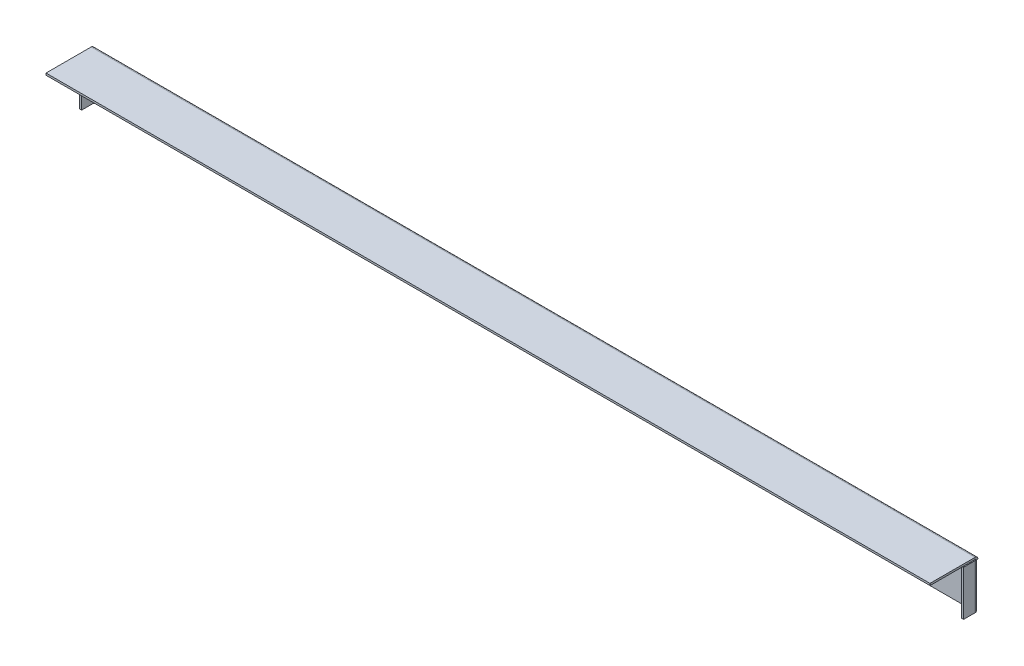
from build123d import *

# Parameters (mm, degrees)
BASEFLANGE_W                   = 920
BASEFLANGE_H                   = 50
BASE_FLANGE1_DEPTH             = 2
EDGE_FLANGE1_STRIP_W           = 10
EDGE_FLANGE1_STRIP_H           = 2
EDGE_FLANGE1_STRIP_CUT_DEPTH   = 920
EDGE_FLANGE1_DEPTH             = 920
EDGE_FLANGE2_STRIP_W           = 10
EDGE_FLANGE2_STRIP_H           = 2
EDGE_FLANGE2_STRIP_CUT_DEPTH   = 47
EDGE_FLANGE2_STRIP_2_W         = 10
EDGE_FLANGE2_STRIP_2_H         = 2
EDGE_FLANGE2_STRIP_CUT_2_DEPTH = 47
EDGE_FLANGE2_DEPTH             = 47
EDGE_FLANGE2_BEND_DEPTH        = 47


# Sheet-metal steps are written as plain solids
with BuildPart() as part:
    # BaseFlange → Base-Flange1 (new body)
    with BuildSketch(Plane.XY):
        with Locations((0, -25)):
            Rectangle(BASEFLANGE_W, BASEFLANGE_H)
    extrude(amount=BASE_FLANGE1_DEPTH)

    # Edge-Flange1 strip (across the edge) → Edge-Flange1 strip cut (cut)
    with BuildSketch(Plane(origin=(460, 0, 2), x_dir=(0, -1, 0), z_dir=(-1, 0, 0))):
        with Locations((-2, -1)):
            Rectangle(EDGE_FLANGE1_STRIP_W, EDGE_FLANGE1_STRIP_H)
    extrude(amount=EDGE_FLANGE1_STRIP_CUT_DEPTH, mode=Mode.SUBTRACT)

    # Edge-Flange1 section (across the edge) → Edge-Flange1 (add)
    with BuildSketch(Plane(origin=(460, 0, 2), x_dir=(0, -1, 0), z_dir=(-1, 0, 0))):
        with BuildLine():
            Line((0, 1), (0, 48))
            Line((0, 48), (2, 48))
            Line((2, 48), (2, 1))
            ThreePointArc((2, 1), (2.292893219, 0.292893219), (3, 0))
            Line((3, 0), (3, -2))
            ThreePointArc((3, -2), (0.878679656, -1.121320344), (0, 1))
        make_face()
    extrude(amount=EDGE_FLANGE1_DEPTH)

    # Edge-Flange2 strip (across the edge) → Edge-Flange2 strip cut (cut)
    with BuildSketch(Plane(origin=(460, -50, 2), x_dir=(-1, 0, 0), z_dir=(0, 1, 0))):
        with Locations((-2, -1)):
            Rectangle(EDGE_FLANGE2_STRIP_W, EDGE_FLANGE2_STRIP_H)
    extrude(amount=EDGE_FLANGE2_STRIP_CUT_DEPTH, mode=Mode.SUBTRACT)

    # Edge-Flange2 strip 2 (across the edge) → Edge-Flange2 strip cut 2 (cut)
    with BuildSketch(Plane(origin=(-460, -3, 2), x_dir=(1, 0, 0), z_dir=(0, -1, 0))):
        with Locations((-2, -1)):
            Rectangle(EDGE_FLANGE2_STRIP_2_W, EDGE_FLANGE2_STRIP_2_H)
    extrude(amount=EDGE_FLANGE2_STRIP_CUT_2_DEPTH, mode=Mode.SUBTRACT)

    # Edge-Flange2 section (across the edge) → Edge-Flange2 (add)
    with BuildSketch(Plane(origin=(460, -50, 2), x_dir=(-1, 0, 0), z_dir=(0, 1, 0))):
        with BuildLine():
            Line((0, 1), (0, 13))
            Line((0, 13), (2, 13))
            Line((2, 13), (2, 1))
            ThreePointArc((2, 1), (2.292893219, 0.292893219), (3, 0))
            Line((3, 0), (3, -2))
            ThreePointArc((3, -2), (0.878679656, -1.121320344), (0, 1))
        make_face()
    extrude(amount=EDGE_FLANGE2_DEPTH)

    # Edge-Flange2 section 2 (across the edge) → Edge-Flange2 bend (add)
    with BuildSketch(Plane(origin=(-460, -3, 2), x_dir=(1, 0, 0), z_dir=(0, -1, 0))):
        with BuildLine():
            Line((0, 1), (0, 13))
            Line((0, 13), (2, 13))
            Line((2, 13), (2, 1))
            ThreePointArc((2, 1), (2.292893219, 0.292893219), (3, 0))
            Line((3, 0), (3, -2))
            ThreePointArc((3, -2), (0.878679656, -1.121320344), (0, 1))
        make_face()
    extrude(amount=EDGE_FLANGE2_BEND_DEPTH)


solid = part.part
